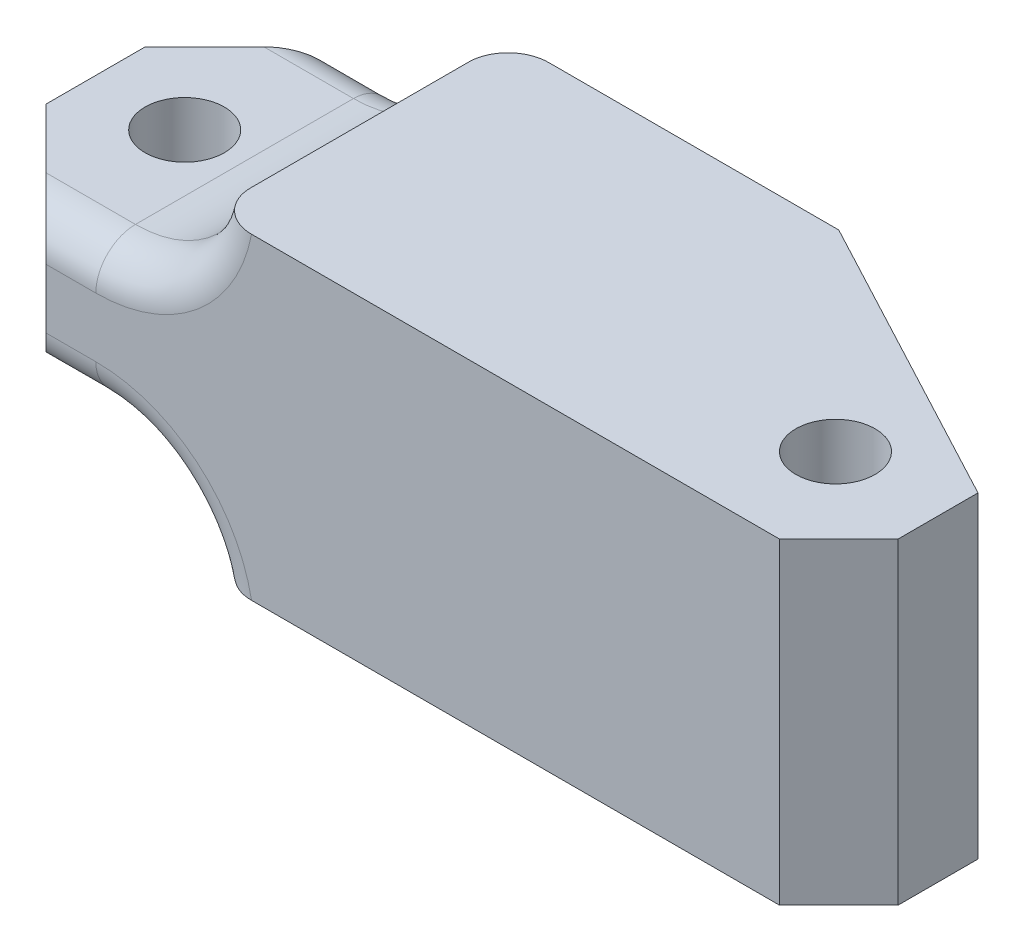
from build123d import *

# Parameters (mm, degrees)
SKETCH_1_W          = 45
SKETCH_1_H          = 16
EXTRUDE_1_DEPTH     = 15
SKETCH_2_W          = 16.428070739
SKETCH_2_H          = 9.700994635
CUT_EXTRUDE_2_DEPTH = 29.200177304
CHAMFER_2_SIZE      = 5
SKETCH_3_R          = 2
CUT_EXTRUDE_3_DEPTH = 30.38537051
SKETCH_4_R          = 2
CUT_EXTRUDE_1_DEPTH = 32.420534687
CHAMFER_13_SIZE     = 3
CHAMFER_14_SIZE     = 15
CHAMFER_14_SIZE2    = 7.975641475
FILLET_5_R          = 6
FILLET_6_R          = 2


with BuildPart() as part:
    # Эскиз1 → Вытянуть1 (new body)
    with BuildSketch(Plane.XY):
        Rectangle(SKETCH_1_W, SKETCH_1_H)
    extrude(amount=EXTRUDE_1_DEPTH)

    # Эскиз2 → Вытянуть2 (cut, through all)
    with BuildSketch(Plane.XY.offset(15)):
        with Locations((-17.390581002, -8.350497318)):
            Rectangle(SKETCH_2_W, SKETCH_2_H)
        with Locations((-17.390581002, 8.350497318)):
            Rectangle(SKETCH_2_W, SKETCH_2_H)
    extrude(amount=-CUT_EXTRUDE_2_DEPTH, mode=Mode.SUBTRACT)

    # Фаска2
    chamfer_2_edges = [part.edges().sort_by_distance(p)[0] for p in [
        (-22.5, 0, 0),
        (-22.5, 0, 15),
    ]]
    chamfer(chamfer_2_edges, length=CHAMFER_2_SIZE)

    # Эскиз3 → Вытянуть3 (cut, through all)
    with BuildSketch(Plane.XZ.offset(3.5)):
        with Locations((-17.875553024, 7.626170468)):
            Circle(SKETCH_3_R)
    extrude(amount=-CUT_EXTRUDE_3_DEPTH, mode=Mode.SUBTRACT)

    # Эскиз4 → Вырез-Вытянуть1 (cut, through all)
    with BuildSketch(Plane(origin=(0, 8, 0), x_dir=(1, 0, 0), z_dir=(0, 1, 0))):
        with Locations(Location((17.10092862, -9.768048927, 0), (0, 0, 270))):
            Circle(SKETCH_4_R)
    extrude(amount=-CUT_EXTRUDE_1_DEPTH, mode=Mode.SUBTRACT)

    # Фаска13
    chamfer_13_edges = [part.edges().sort_by_distance(p)[0] for p in [
        (22.5, 0, 15),
    ]]
    chamfer(chamfer_13_edges, length=CHAMFER_13_SIZE)

    # Фаска14
    chamfer_14_edges = [part.edges().sort_by_distance(p)[0] for p in [
        (22.5, 0, 0),
    ]]
    chamfer_14_side = [part.faces().sort_by_distance(p)[0] for p in [
        (4.599602818, 0, 0),
    ]]
    chamfer(chamfer_14_edges, length=CHAMFER_14_SIZE, length2=CHAMFER_14_SIZE2, reference=chamfer_14_side[0])

    # Скругление5
    # the kernel refuses this fillet: 6 mm, written as the material it adds along each edge
    with BuildSketch(Plane(origin=(-9.176545632, -3.5, 15), x_dir=(0, -1, 0), z_dir=(0, 0, -1))) as fillet_5_piece_1:
        with BuildLine():
            CenterArc((6, 5.809475019), FILLET_5_R, 180, 75.522487814)
            Line((0, 5.809475019), (-0.12, 5.809475019))
            Line((-0.12, 5.809475019), (-0.12, 0))
            Line((-0.12, 0), (0, -0.12))
            ThreePointArc((0, -0.12), (2.25, -0.12), (4.47, -0.1161895))
            Line((4.47, -0.1161895), (4.5, 0))
        make_face()
    extrude(amount=15)
    with BuildSketch(Plane(origin=(-9.176545632, 3.5, 15), x_dir=(0, 1, 0), z_dir=(0, 0, -1))) as fillet_5_piece_2:
        with BuildLine():
            CenterArc((6, -5.809475019), FILLET_5_R, 104.477512186, 75.522487814)
            Line((0, -5.809475019), (-0.12, -5.809475019))
            Line((-0.12, -5.809475019), (-0.12, 0))
            Line((-0.12, 0), (0, 0.12))
            ThreePointArc((0, 0.12), (2.25, 0.12), (4.47, 0.1161895))
            Line((4.47, 0.1161895), (4.5, 0))
        make_face()
    extrude(amount=15)

    # Скругление6
    fillet_6_edges = [part.edges().sort_by_distance(p)[0] for p in [
        (-9.176545632, -8, 7.5),
        (-16.243010326, 3.5, 0),
        (-16.243010326, 3.5, 15),
        (-16.243010326, -3.5, 0),
        (-16.243010326, -3.5, 15),
        (-11.311786037, -4.75658351, 15),
        (-11.311786037, -4.75658351, 0),
        (-11.311786037, 4.75658351, 15),
        (-11.311786037, 4.75658351, 0),
    ]]
    fillet(fillet_6_edges, radius=FILLET_6_R)


solid = part.part
